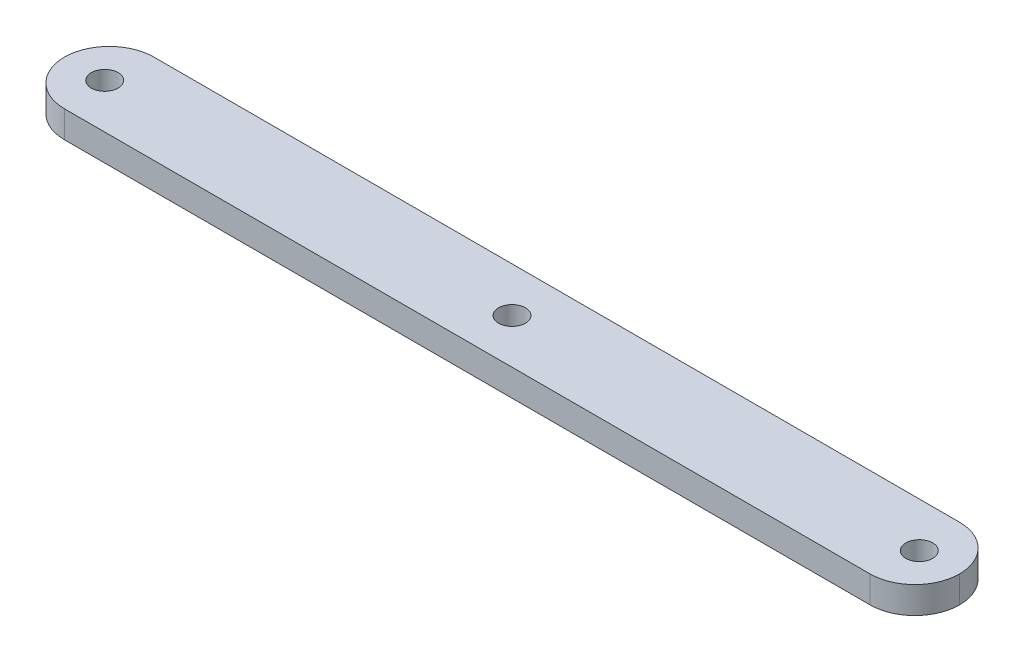
from build123d import *

# Parameters (mm, degrees)
SKETCH2_W           = 200
SKETCH2_H           = 20
BOSS_EXTRUDE1_DEPTH = 6
SKETCH3_R           = 3
CUT_EXTRUDE1_DEPTH  = 202.087045828
SKETCH4_R           = 3
CUT_EXTRUDE2_DEPTH  = 202.087045828
FILLET1_R           = 10
FILLET2_R           = 10
SKETCH6_R           = 3
CUT_EXTRUDE3_DEPTH  = 202.087045828


with BuildPart() as part:
    # Sketch2 → Boss-Extrude1 (new body)
    with BuildSketch(Plane(origin=(0, 0, 0), x_dir=(1, 0, 0), z_dir=(0, 1, 0))):
        with Locations((100, 10)):
            Rectangle(SKETCH2_W, SKETCH2_H)
    extrude(amount=BOSS_EXTRUDE1_DEPTH)

    # Sketch3 → Cut-Extrude1 (cut, through all)
    with BuildSketch(Plane(origin=(0, 6, 0), x_dir=(1, 0, 0), z_dir=(0, 1, 0))):
        with Locations(Location((9, 10, 0), (0, 0, 270))):
            Circle(SKETCH3_R)
    extrude(amount=-CUT_EXTRUDE1_DEPTH, mode=Mode.SUBTRACT)

    # Sketch4 → Cut-Extrude2 (cut, through all)
    with BuildSketch(Plane(origin=(0, 6, 0), x_dir=(1, 0, 0), z_dir=(0, 1, 0))):
        with Locations(Location((191, 10, 0), (0, 0, 270))):
            Circle(SKETCH4_R)
    extrude(amount=-CUT_EXTRUDE2_DEPTH, mode=Mode.SUBTRACT)

    # Fillet1
    fillet1_edges = [part.edges().sort_by_distance(p)[0] for p in [
        (0, 3, -20),
        (0, 3, 0),
    ]]
    fillet(fillet1_edges, radius=FILLET1_R - 0.0001)  # a hair under: the kernel refuses the full size

    # Fillet2
    fillet2_edges = [part.edges().sort_by_distance(p)[0] for p in [
        (200, 3, -20),
        (200, 3, 0),
    ]]
    fillet(fillet2_edges, radius=FILLET2_R - 0.0001)  # a hair under: the kernel refuses the full size

    # Sketch6 → Cut-Extrude3 (cut, through all)
    with BuildSketch(Plane(origin=(0, 6, 0), x_dir=(1, 0, 0), z_dir=(0, 1, 0))):
        with Locations(Location((100, 10, 0), (0, 0, 270))):
            Circle(SKETCH6_R)
    extrude(amount=-CUT_EXTRUDE3_DEPTH, mode=Mode.SUBTRACT)


solid = part.part
